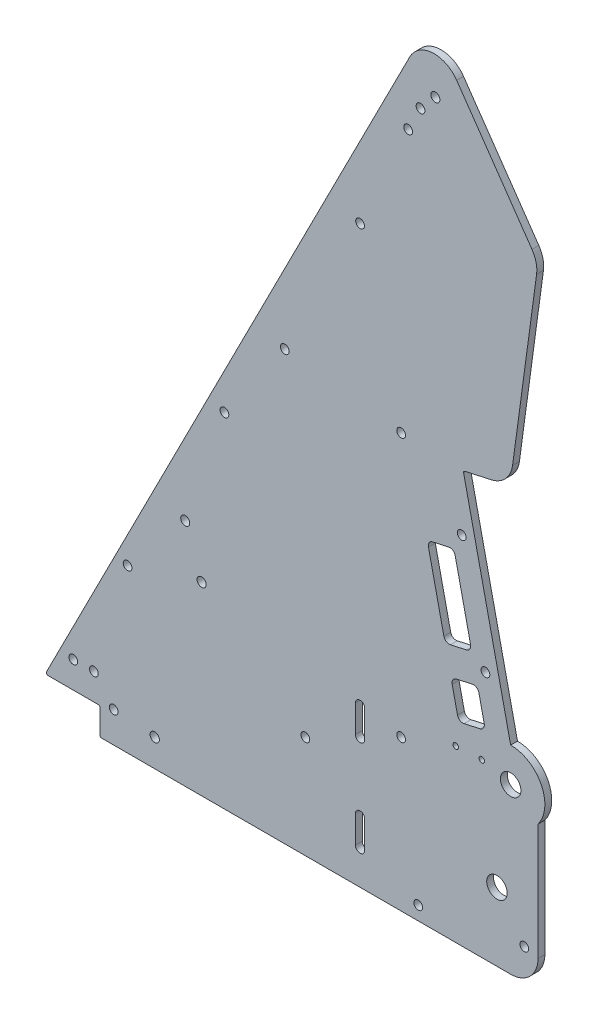
from build123d import *

# Parameters (mm, degrees)
BOSS_EXTRUDE1_DEPTH     = 3.175
SKETCH2_R               = 2.0955
SKETCH2_R_2             = 2.032
SKETCH2_R_3             = 4.7625
CUT_EXTRUDE1_DEPTH      = 421.976111717
SKETCH7_R               = 2.159
CUT_EXTRUDE2_DEPTH      = 421.976111717
CUT_EXTRUDE3_REACH      = 422.976
SKETCH10_R              = 2.032
FILLET1_R               = 12.7
FILLET2_R               = 0.79375
SKETCH12_R              = 2.032
CUT_EXTRUDE5_DEPTH      = 411.989226146
CUT_EXTRUDE6_DEPTH      = 411.989226146
CUT_EXTRUDE6_DEPTH_BACK = 411.989226146
SKETCH13_R              = 1.27
CUT_EXTRUDE7_REACH      = 412.989
SKETCH14_R              = 2.032
SKETCH15_R              = 2.032
CUT_EXTRUDE8_DEPTH      = 411.989226146
FILLET3_R               = 2.54


with BuildPart() as part:
    # Sketch1 → Boss-Extrude1 (new body)
    with BuildSketch(Plane.XY):
        with BuildLine():
            Line((228.6, -12.7), (228.6, 53.975))
            ThreePointArc((228.6, 53.975), (230.099031657, 70.599515829), (215.9, 79.375))
            Line((215.9, 79.375), (193.909735224, 178.566674323))
            Line((193.909735224, 178.566674323), (215.607913982, 183.377044743))
            Line((215.607913982, 183.377044743), (228.6, 279.4))
            Line((228.6, 279.4), (178.754725958, 351.413083686))
            Line((178.754725958, 351.413083686), (0, 0))
            Line((0, 0), (25.4, 0))
            Line((25.4, 0), (25.4, -12.7))
            Line((25.4, -12.7), (228.6, -12.7))
        make_face()
    extrude(amount=BOSS_EXTRUDE1_DEPTH)

    # Sketch2 → Cut-Extrude1 (cut, through all)
    with BuildSketch(Plane.XY.offset(3.175)):
        with Locations((64.943150167, 94.057839899)):
            Circle(SKETCH2_R)
        with Locations((180.975, 322.164313376)):
            Circle(SKETCH2_R)
        with Locations((72.544547852, 73.173171402)):
            Circle(SKETCH2_R)
        with Locations((193.207821773, 152.394364194)):
            Circle(SKETCH2_R_2)
        with Locations((215.9, 63.5)):
            Circle(SKETCH2_R_3)
        with Locations((173.0375, -6.35)):
            Circle(SKETCH2_R_2)
        with Locations((204.202954161, 102.798527032)):
            Circle(SKETCH2_R_2)
        with Locations((209.55, 19.05)):
            Circle(SKETCH2_R_3)
        with Locations((165.1, 179.3875)):
            Circle(SKETCH2_R_2)
    extrude(amount=-CUT_EXTRUDE1_DEPTH, mode=Mode.SUBTRACT)

    # Sketch7 → Cut-Extrude2 (cut, through all)
    with BuildSketch(Plane.XY.offset(3.175)):
        with Locations((50.8, 0)):
            Circle(SKETCH7_R)
        with BuildLine():
            Line((143.891, 3.175), (143.891, 15.875))
            ThreePointArc((143.891, 15.875), (146.05, 18.034), (148.209, 15.875))
            Line((148.209, 15.875), (148.209, 3.175))
            ThreePointArc((148.209, 3.175), (146.05, 1.016), (143.891, 3.175))
        make_face()
        with BuildLine():
            Line((143.891, 47.625), (143.891, 60.325))
            ThreePointArc((143.891, 60.325), (146.05, 62.484), (148.209, 60.325))
            Line((148.209, 60.325), (148.209, 47.625))
            ThreePointArc((148.209, 47.625), (146.05, 45.466), (143.891, 47.625))
        make_face()
    extrude(amount=-CUT_EXTRUDE2_DEPTH, mode=Mode.SUBTRACT)

    # Sketch10 → Cut-Extrude3 (cut, up to next)
    with BuildSketch(Plane.XY.offset(3.175), mode=Mode.PRIVATE) as cut_extrude3_sk1:
        with Locations((165.1, 57.15)):
            Circle(SKETCH10_R)
    cut_extrude3_tool1 = extrude(cut_extrude3_sk1.sketch, amount=-CUT_EXTRUDE3_REACH, mode=Mode.PRIVATE) & part.part
    # Sketch10 → Cut-Extrude3 (cut, up to next)
    with BuildSketch(Plane.XY.offset(3.175), mode=Mode.PRIVATE) as cut_extrude3_sk2:
        with Locations((120.65, 34.925)):
            Circle(SKETCH10_R)
    cut_extrude3_tool2 = extrude(cut_extrude3_sk2.sketch, amount=-CUT_EXTRUDE3_REACH, mode=Mode.PRIVATE) & part.part
    # Sketch10 → Cut-Extrude3 (cut, up to next)
    with BuildSketch(Plane.XY.offset(3.175), mode=Mode.PRIVATE) as cut_extrude3_sk3:
        with Locations((13.046467246, 12.334704411)):
            Circle(SKETCH10_R)
    cut_extrude3_tool3 = extrude(cut_extrude3_sk3.sketch, amount=-CUT_EXTRUDE3_REACH, mode=Mode.PRIVATE) & part.part
    # Sketch10 → Cut-Extrude3 (cut, up to next)
    with BuildSketch(Plane.XY.offset(3.175), mode=Mode.PRIVATE) as cut_extrude3_sk4:
        with Locations((22.571467246, 12.334704411)):
            Circle(SKETCH10_R)
    cut_extrude3_tool4 = extrude(cut_extrude3_sk4.sketch, amount=-CUT_EXTRUDE3_REACH, mode=Mode.PRIVATE) & part.part
    # Sketch10 → Cut-Extrude3 (cut, up to next)
    with BuildSketch(Plane.XY.offset(3.175), mode=Mode.PRIVATE) as cut_extrude3_sk5:
        with Locations((38.211447917, 62.639810909)):
            Circle(SKETCH10_R)
    cut_extrude3_tool5 = extrude(cut_extrude3_sk5.sketch, amount=-CUT_EXTRUDE3_REACH, mode=Mode.PRIVATE) & part.part
    add(cut_extrude3_tool1.solids().sort_by_distance((165.1, 57.15, 3.175))[0], mode=Mode.SUBTRACT)
    add(cut_extrude3_tool2.solids().sort_by_distance((120.65, 34.925, 3.175))[0], mode=Mode.SUBTRACT)
    add(cut_extrude3_tool3.solids().sort_by_distance((13.046467, 12.334704, 3.175))[0], mode=Mode.SUBTRACT)
    add(cut_extrude3_tool4.solids().sort_by_distance((22.571467, 12.334704, 3.175))[0], mode=Mode.SUBTRACT)
    add(cut_extrude3_tool5.solids().sort_by_distance((38.211448, 62.639811, 3.175))[0], mode=Mode.SUBTRACT)

    # Fillet1
    fillet1_edges = [part.edges().sort_by_distance(p)[0] for p in [
        (228.6, -12.7, 1.5875),
        (178.754725958, 351.413083686, 1.5875),
        (215.607913982, 183.377044743, 1.5875),
        (228.6, 279.4, 1.5875),
    ]]
    fillet(fillet1_edges, radius=FILLET1_R)

    # Fillet2
    fillet2_edges = [part.edges().sort_by_distance(p)[0] for p in [
        (25.4, -12.7, 1.5875),
        (25.4, 0, 1.5875),
        (193.909735224, 178.566674323, 1.5875),
        (0, 0, 1.5875),
    ]]
    fillet(fillet2_edges, radius=FILLET2_R)

    # Sketch12 → Cut-Extrude5 (cut, through all)
    with BuildSketch(Plane.XY.offset(3.175)):
        with Locations((31.75, 1.5875)):
            Circle(SKETCH12_R)
        with Locations((222.25, 1.5875)):
            Circle(SKETCH12_R)
    extrude(amount=-CUT_EXTRUDE5_DEPTH, mode=Mode.SUBTRACT)

    # Sketch13 → Cut-Extrude6 (cut, two sides: drawn at the far end of the back side and taken through both)
    with BuildSketch(Plane.XY.offset(3.175).offset(-CUT_EXTRUDE6_DEPTH_BACK)):
        with Locations((190.426832263, 66.260948917)):
            Circle(SKETCH13_R)
        with Locations((202.533497378, 66.789537331)):
            Circle(SKETCH13_R)
        Polygon((189.622629605, 145.09537131), (197.868978896, 107.898493439), (185.470019606, 105.149710342), (177.223670315, 142.346588213), align=None)
        Polygon((188.218802703, 92.750751051), (200.617761993, 95.499534148), (204.191180019, 79.380887071), (191.792220729, 76.632103974), align=None)
    extrude(amount=CUT_EXTRUDE6_DEPTH + CUT_EXTRUDE6_DEPTH_BACK, mode=Mode.SUBTRACT)

    # Sketch14 → Cut-Extrude7 (cut, up to next)
    with BuildSketch(Plane.XY.offset(3.175), mode=Mode.PRIVATE) as cut_extrude7_sk1:
        with Locations((146.05, 254)):
            Circle(SKETCH14_R)
    cut_extrude7_tool1 = extrude(cut_extrude7_sk1.sketch, amount=-CUT_EXTRUDE7_REACH, mode=Mode.PRIVATE) & part.part
    # Sketch14 → Cut-Extrude7 (cut, up to next)
    with BuildSketch(Plane.XY.offset(3.175), mode=Mode.PRIVATE) as cut_extrude7_sk2:
        with Locations((111.125, 186.055)):
            Circle(SKETCH14_R)
    cut_extrude7_tool2 = extrude(cut_extrude7_sk2.sketch, amount=-CUT_EXTRUDE7_REACH, mode=Mode.PRIVATE) & part.part
    add(cut_extrude7_tool1.solids().sort_by_distance((146.05, 254, 3.175))[0], mode=Mode.SUBTRACT)
    add(cut_extrude7_tool2.solids().sort_by_distance((111.125, 186.055, 3.175))[0], mode=Mode.SUBTRACT)

    # Sketch15 → Cut-Extrude8 (cut, through all)
    with BuildSketch(Plane.XY.offset(3.175)):
        with Locations((83.136819993, 146.631489078)):
            Circle(SKETCH15_R)
        with Locations((174.099449815, 314.249967391)):
            Circle(SKETCH15_R)
        with Locations((168.341422739, 302.930288765)):
            Circle(SKETCH15_R)
    extrude(amount=-CUT_EXTRUDE8_DEPTH, mode=Mode.SUBTRACT)

    # Fillet3
    fillet3_edges = [part.edges().sort_by_distance(p)[0] for p in [
        (177.223670315, 142.346588213, 1.5875),
        (189.622629605, 145.09537131, 1.5875),
        (197.868978896, 107.898493439, 1.5875),
        (185.470019606, 105.149710342, 1.5875),
        (200.617761993, 95.499534148, 1.5875),
        (188.218802703, 92.750751051, 1.5875),
        (191.792220729, 76.632103974, 1.5875),
        (204.191180019, 79.380887071, 1.5875),
    ]]
    fillet(fillet3_edges, radius=FILLET3_R)


solid = part.part
